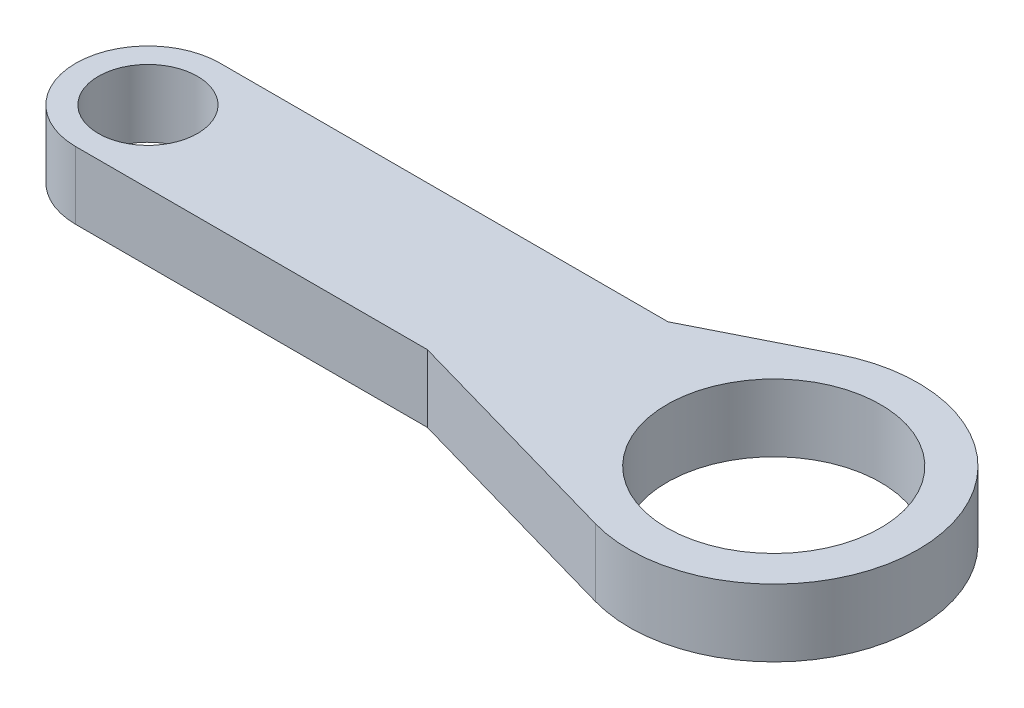
from build123d import *

# Parameters (mm, degrees)
SKETCH2_R           = 11.1
SKETCH2_R_2         = 5.15
BOSS_EXTRUDE2_DEPTH = 3.5


with BuildPart() as part:
    # Sketch2 → Boss-Extrude2 (new, symmetric)
    with BuildSketch(Plane(origin=(0, 0, 0), x_dir=(1, 0, 0), z_dir=(0, 1, 0))):
        with BuildLine():
            Line((-18.484269322, 7.5), (-65, 7.5))
            ThreePointArc((-65, 7.5), (-72.5, 0), (-65, -7.5))
            Line((-65, -7.5), (-28.484269322, -7.5))
            Line((-28.484269322, -7.5), (-4.099945578, -14.428806127))
            ThreePointArc((-4.099945578, -14.428806127), (14.933269082, 1.413320387), (-6.734057037, 13.403450146))
            Line((-6.734057037, 13.403450146), (-18.484269322, 7.5))
        make_face()
        Circle(SKETCH2_R, mode=Mode.SUBTRACT)
        with Locations((-65, 0)):
            Circle(SKETCH2_R_2, mode=Mode.SUBTRACT)
    extrude(amount=BOSS_EXTRUDE2_DEPTH, both=True)


solid = part.part
